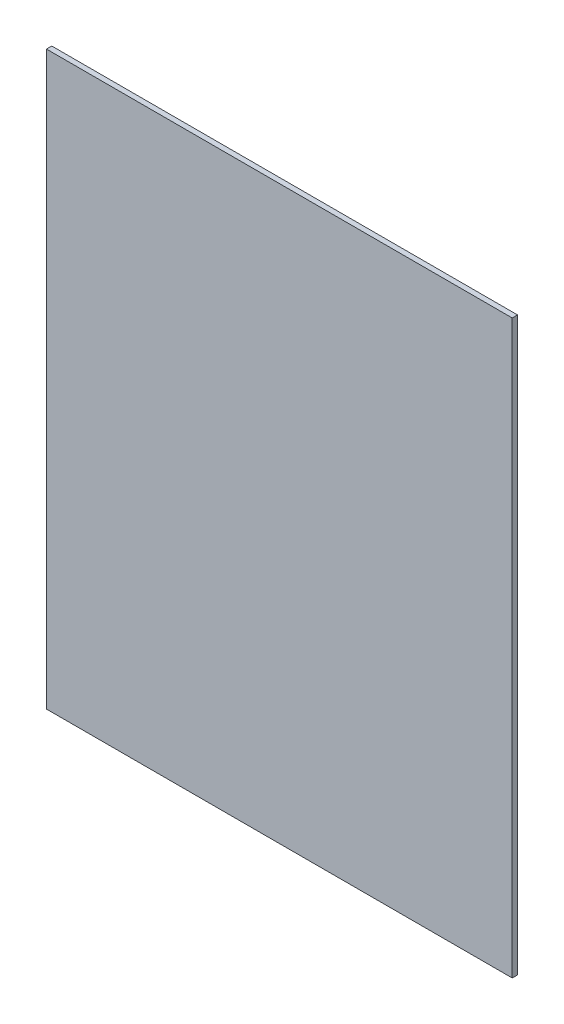
from build123d import *

# Parameters (mm, degrees)
SKETCH1_W           = 279.4
SKETCH1_H           = 342.9
BOSS_EXTRUDE1_DEPTH = 3.175


with BuildPart() as part:
    # Sketch1 → Boss-Extrude1 (new body)
    with BuildSketch(Plane.XY):
        with Locations((-139.7, -171.45)):
            Rectangle(SKETCH1_W, SKETCH1_H)
    extrude(amount=BOSS_EXTRUDE1_DEPTH)


solid = part.part
